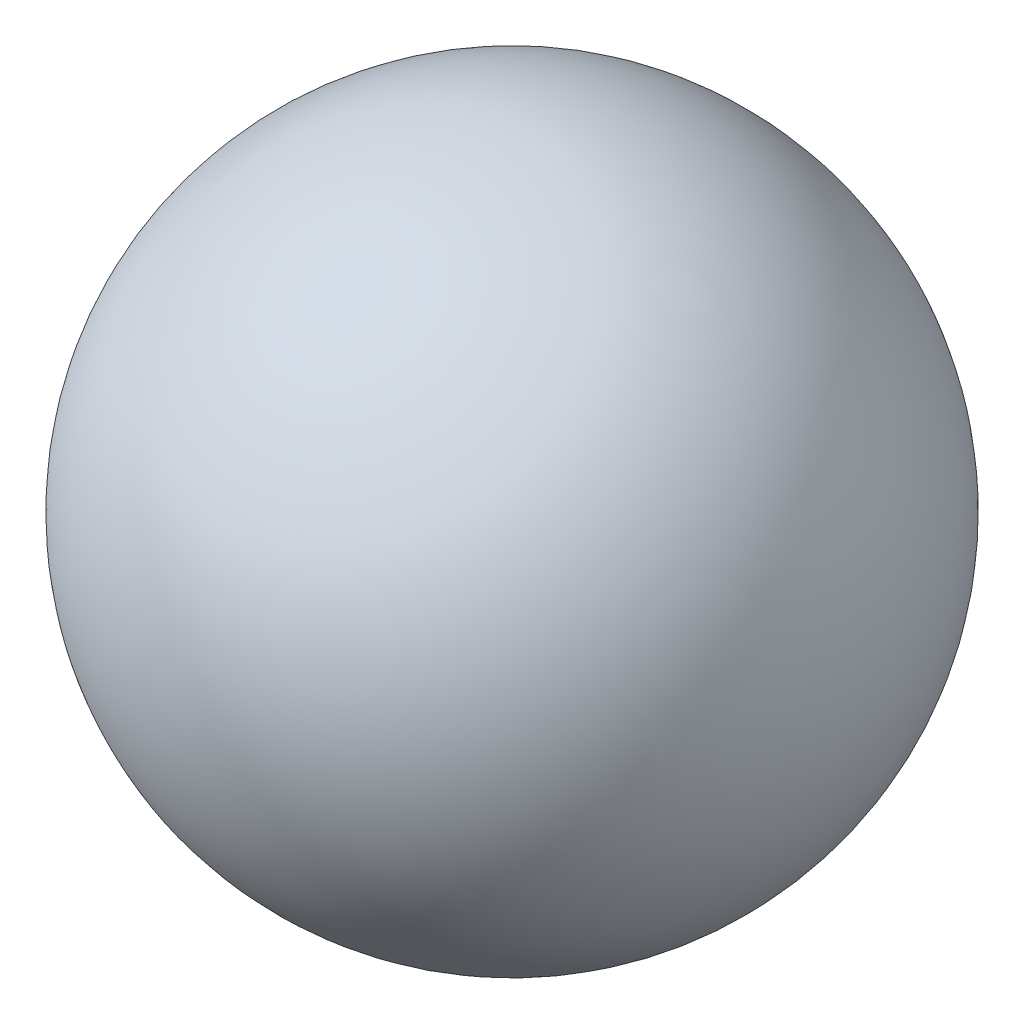
from build123d import *


# Read off the part's stored shape, not the designer's step: Split1
with BuildPart() as part:
    # Sketch1 → Revolve2 (revolve)
    with BuildSketch(Plane.XY):
        with BuildLine():
            Line((0, -147.5), (0, -150.5))
            ThreePointArc((0, -150.5), (150.5, 0), (0, 150.5))
            Line((0, 150.5), (0, 147.5))
            ThreePointArc((0, 147.5), (147.5, 0), (0, -147.5))
        make_face()
    revolve(axis=Axis((0, -147.5, 0), (0, 1, 0)))


with BuildPart() as body_2:
    # Split1: the piece on the far side of the plane
    add(part.part)
    split(bisect_by=Plane.XY.offset(-129.832), keep=Keep.BOTTOM)


with BuildPart() as part_1:
    add(part.part)

    # Split1
    split(bisect_by=Plane.XY.offset(-129.832), keep=Keep.TOP)


solid = Compound([body_2.part, part_1.part])
